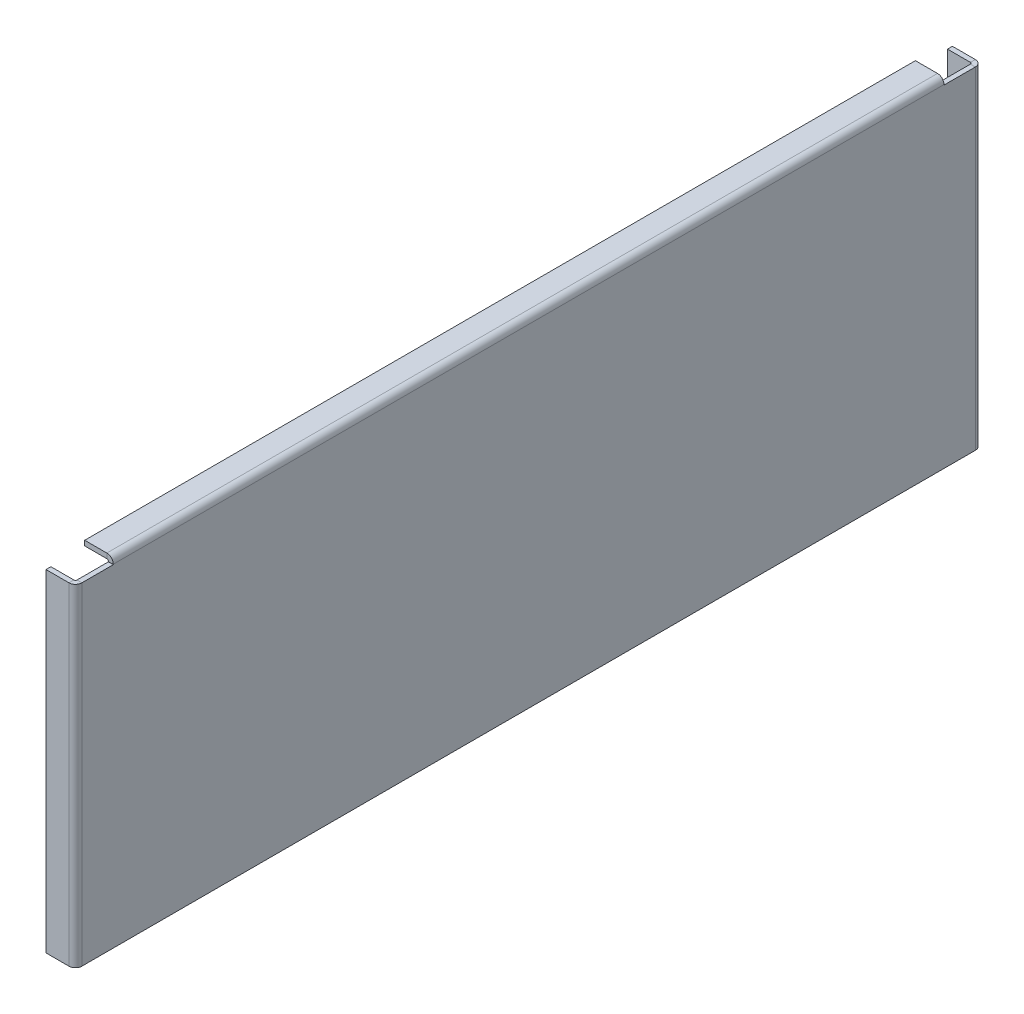
from build123d import *

# Parameters (mm, degrees)
SKETCH1_W               = 575.31
SKETCH1_H               = 214.9475
BASE_FLANGE1_DEPTH      = 3.175
EDGE_FLANGE1_DEPTH      = 214.9475
EDGE_FLANGE1_BEND_DEPTH = 214.9475
EDGE_FLANGE2_DEPTH      = 537.75


# Sheet-metal steps are written as plain solids
with BuildPart() as part:
    # Sketch1 → Base-Flange1 (new body)
    with BuildSketch(Plane(origin=(0, 0, 0), x_dir=(0, 0, -1), z_dir=(1, 0, 0))):
        Rectangle(SKETCH1_W, SKETCH1_H)
    extrude(amount=-BASE_FLANGE1_DEPTH)

    # Edge-Flange1 section (across the edge) → Edge-Flange1 (add)
    with BuildSketch(Plane(origin=(-3.175, 107.47375, -290.195), x_dir=(0, 0, 1), z_dir=(0, -1, 0))):
        with BuildLine():
            Line((-3.175, 1), (-3.175, 15.875))
            Line((-3.175, 15.875), (0, 15.875))
            Line((0, 15.875), (0, 1))
            ThreePointArc((0, 1), (0.292893219, 0.292893219), (1, 0))
            Line((1, 0), (2.54, 0))
            Line((2.54, 0), (2.54, -3.175))
            Line((2.54, -3.175), (1, -3.175))
            ThreePointArc((1, -3.175), (-1.952170811, -1.952170811), (-3.175, 1))
        make_face()
    extrude(amount=EDGE_FLANGE1_DEPTH)

    # Edge-Flange1 section 2 (across the edge) → Edge-Flange1 bend (add)
    with BuildSketch(Plane(origin=(-3.175, -107.47375, 290.195), x_dir=(0, 0, -1), z_dir=(0, 1, 0))):
        with BuildLine():
            Line((-3.175, 1), (-3.175, 15.875))
            Line((-3.175, 15.875), (0, 15.875))
            Line((0, 15.875), (0, 1))
            ThreePointArc((0, 1), (0.292893219, 0.292893219), (1, 0))
            Line((1, 0), (2.54, 0))
            Line((2.54, 0), (2.54, -3.175))
            Line((2.54, -3.175), (1, -3.175))
            ThreePointArc((1, -3.175), (-1.952170811, -1.952170811), (-3.175, 1))
        make_face()
    extrude(amount=EDGE_FLANGE1_BEND_DEPTH)

    # Edge-Flange2 section (across the edge) → Edge-Flange2 (add)
    with BuildSketch(Plane(origin=(-3.175, 108.74375, 268.875), x_dir=(0, -1, 0), z_dir=(0, 0, -1))):
        with BuildLine():
            Line((-3.175, 1), (-3.175, 15.326869713))
            Line((-3.175, 15.326869713), (0, 15.326869713))
            Line((0, 15.326869713), (0, 1))
            ThreePointArc((0, 1), (0.292893219, 0.292893219), (1, 0))
            Line((1, 0), (1.27, 0))
            Line((1.27, 0), (1.27, -3.175))
            Line((1.27, -3.175), (1, -3.175))
            ThreePointArc((1, -3.175), (-1.952170811, -1.952170811), (-3.175, 1))
        make_face()
    extrude(amount=EDGE_FLANGE2_DEPTH)


solid = part.part
